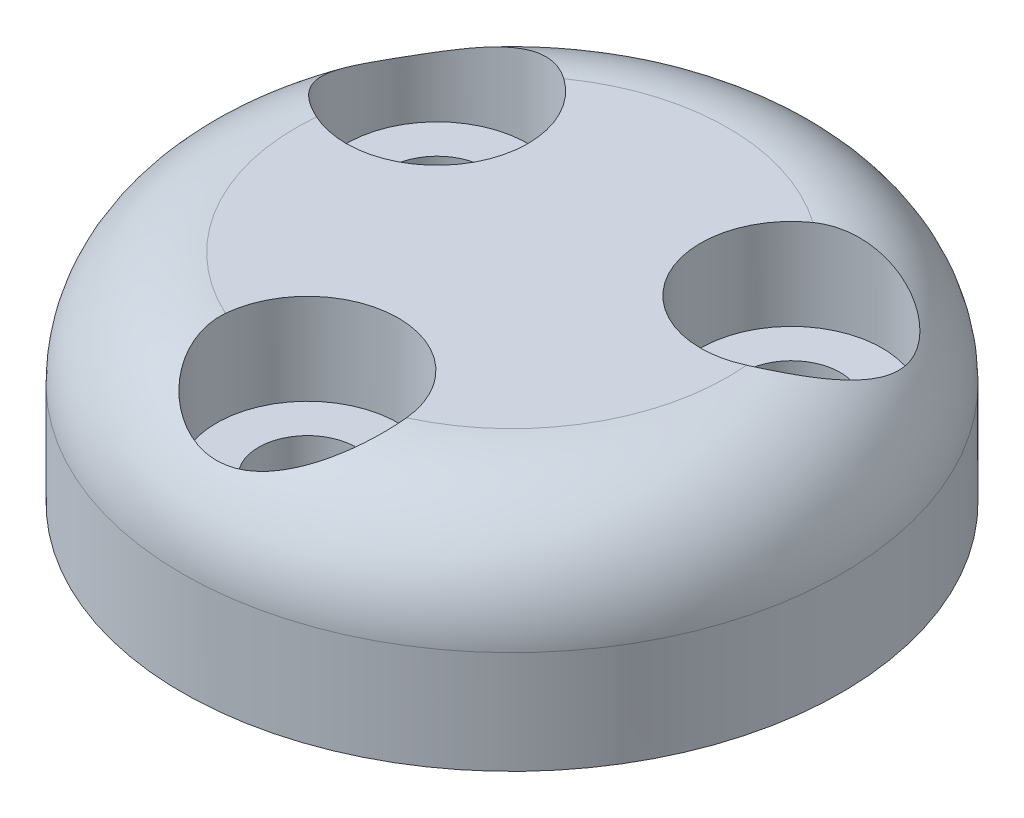
from build123d import *

# Parameters (mm, degrees)
SKETCH1_R                      = 14.5
BOSS_EXTRUDE1_DEPTH            = 9.525
SKETCH2_R                      = 3.5
CUT_EXTRUDE1_DEPTH             = 3.5
SKETCH3_R                      = 3.125
CUT_EXTRUDE2_DEPTH             = 5
CBORE_FOR_M4_SHCS1_D           = 4.3
CBORE_FOR_M4_SHCS1_CBORE_D     = 8
CBORE_FOR_M4_SHCS1_CBORE_DEPTH = 4
CIRPATTERN1_COUNT              = 3
FILLET1_R                      = 5
CUT_EXTRUDE3_DEPTH             = 5
CIRPATTERN2_COUNT              = 3


with BuildPart() as part:
    # Sketch1 → Boss-Extrude1 (new body)
    with BuildSketch(Plane(origin=(0, 0, 0), x_dir=(1, 0, 0), z_dir=(0, 1, 0))):
        with Locations(Location((0, 0, 0), (0, 0, 90))):
            Circle(SKETCH1_R)
    extrude(amount=BOSS_EXTRUDE1_DEPTH)

    # Sketch2 → Cut-Extrude1 (cut)
    with BuildSketch(Plane.XZ):
        with Locations(Location((0, 0, 0), (0, 0, 270))):
            Circle(SKETCH2_R)
    extrude(amount=-CUT_EXTRUDE1_DEPTH, mode=Mode.SUBTRACT)

    # Sketch3 → Cut-Extrude2 (cut)
    with BuildSketch(Plane.XZ.offset(-3.5)):
        with Locations(Location((0, 0, 0), (0, 0, 270))):
            Circle(SKETCH3_R)
    extrude(amount=-CUT_EXTRUDE2_DEPTH, mode=Mode.SUBTRACT)

    # CBORE for M4 SHCS1 (through all)
    with Locations(Plane(origin=(0, 9.525, 0), x_dir=(-1, 0, 0), z_dir=(0, 1, 0))):
        with Locations((0, 9)):
            cbore_for_m4_shcs1 = CounterBoreHole(CBORE_FOR_M4_SHCS1_D / 2, CBORE_FOR_M4_SHCS1_CBORE_D / 2, CBORE_FOR_M4_SHCS1_CBORE_DEPTH)

    # CirPattern1: CBORE for M4 SHCS1 ×3 about axis
    cirpattern1_axis = Axis((0, 0, 0), (0, 1, 0))
    for i in range(1, CIRPATTERN1_COUNT):
        add(cbore_for_m4_shcs1.rotate(cirpattern1_axis, i * 360 / CIRPATTERN1_COUNT), mode=Mode.SUBTRACT)

    # Fillet1
    # the kernel refuses this fillet: 5 mm, written as the material it takes off along each edge
    with BuildSketch(Plane(origin=(0, 9.525, 0), x_dir=(0, 0, -1), z_dir=(1, 0, 0))) as fillet1_piece_1:
        with BuildLine():
            CenterArc((14.5 - FILLET1_R, -FILLET1_R), FILLET1_R, 0, 90)
            Line((14.5 - FILLET1_R, 0), (14.5, 0))
            Line((14.5, 0), (14.5, -FILLET1_R))
        make_face()
    revolve(axis=Axis((0, 9.525, 0), (0, 1, 0)), mode=Mode.SUBTRACT)

    # Sketch6 → Cut-Extrude3 (cut)
    with BuildSketch(Plane.XZ):
        with BuildLine():
            ThreePointArc((-11.401615906, 1.501051211), (-9.249319233, -1.303876423), (-6.444391599, 0.848420249))
            ThreePointArc((-6.444391599, 0.848420249), (-5.629165125, 3.25), (-3.956949289, 5.156796712))
            ThreePointArc((-3.956949289, 5.156796712), (-3.49546951, 8.662083635), (-7.000756434, 9.123563413))
            ThreePointArc((-7.000756434, 9.123563413), (-9.959292144, 5.75), (-11.401615906, 1.501051211))
        make_face()
    cut_extrude3 = extrude(amount=-CUT_EXTRUDE3_DEPTH, mode=Mode.SUBTRACT)

    # CirPattern2: Cut-Extrude3 ×3 about axis
    cirpattern2_axis = Axis((0, 0, 0), (0, 1, 0))
    for i in range(1, CIRPATTERN2_COUNT):
        add(cut_extrude3.rotate(cirpattern2_axis, i * 360 / CIRPATTERN2_COUNT), mode=Mode.SUBTRACT)


solid = part.part
